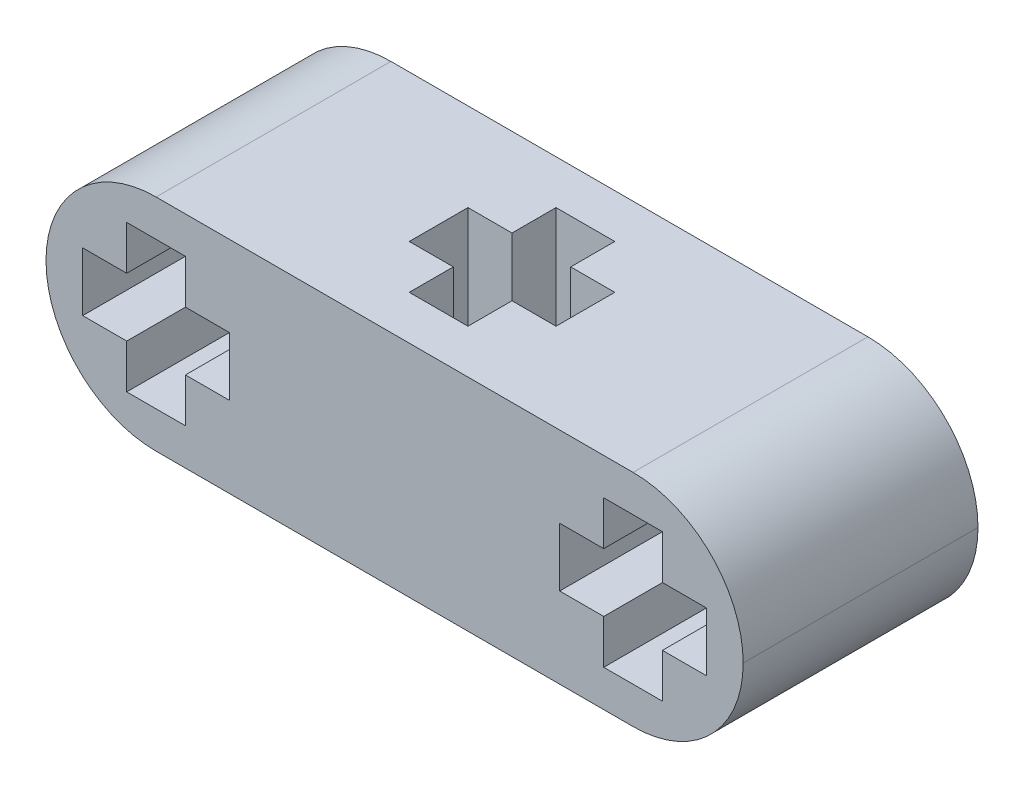
from build123d import *

# Parameters (mm, degrees)
SKETCH1_W           = 23.75
SKETCH1_H           = 7.5
BOSS_EXTRUDE1_DEPTH = 8
FILLET1_R           = 3.75
FILLET2_R           = 3.75
CUT_EXTRUDE13_DEPTH = 27.159367347
CUT_EXTRUDE14_DEPTH = 10


with BuildPart() as part:
    # Sketch1 → Boss-Extrude1 (new body)
    with BuildSketch(Plane.XY):
        with Locations((11.875, 3.75)):
            Rectangle(SKETCH1_W, SKETCH1_H)
    extrude(amount=BOSS_EXTRUDE1_DEPTH)

    # Fillet1
    fillet1_edges = [part.edges().sort_by_distance(p)[0] for p in [
        (23.75, 0, 4),
        (23.75, 7.5, 4),
    ]]
    fillet(fillet1_edges, radius=FILLET1_R - 0.0001)  # a hair under: the kernel refuses the full size

    # Fillet2
    fillet2_edges = [part.edges().sort_by_distance(p)[0] for p in [
        (0, 0, 4),
        (0, 7.5, 4),
    ]]
    fillet(fillet2_edges, radius=FILLET2_R - 0.0001)  # a hair under: the kernel refuses the full size

    # Sketch17 → Cut-Extrude13 (cut, through all)
    with BuildSketch(Plane.XY.offset(8)):
        Polygon((21, 6.25), (20, 6.25), (20, 3.75), (22.5, 3.75), (22.5, 4.75), (21, 4.75), align=None)
        Polygon((20, 3.75), (20, 6.25), (19, 6.25), (19, 4.75), (17.5, 4.75), (17.5, 2.75), (19, 2.75), (19, 1.25), (20, 1.25), align=None)
        Polygon((22.5, 3.75), (20, 3.75), (20, 1.25), (21, 1.25), (21, 2.75), (22.5, 2.75), align=None)
    cut_extrude13 = extrude(amount=-CUT_EXTRUDE13_DEPTH, mode=Mode.SUBTRACT)

    # Mirror4: Cut-Extrude13 across plane
    add(cut_extrude13.mirror(Plane(origin=(11.875, 0, 0), x_dir=(0, 0, 1), z_dir=(1, 0, 0))), mode=Mode.SUBTRACT)

    # Sketch18 → Cut-Extrude14 (cut)
    with BuildSketch(Plane(origin=(0, 7.5, 0), x_dir=(1, 0, 0), z_dir=(0, 1, 0))):
        Polygon((14.375, -4), (11.875, -4), (11.875, -6.5), (12.875, -6.5), (12.875, -5), (14.375, -5), align=None)
        Polygon((11.875, -4), (13.90625, -3), (12.875, -3), (12.875, -1.5), (11.875, -1.5), align=None)
        Polygon((14.375, -3), (13.90625, -3), (11.875, -4), (14.375, -4), align=None)
        Polygon((9.84375, -5), (11.875, -4), (11.875, -1.5), (10.875, -1.5), (10.875, -3), (9.375, -3), (9.375, -5), align=None)
        Polygon((11.875, -6.5), (11.875, -4), (9.84375, -5), (10.875, -5), (10.875, -6.5), align=None)
    extrude(amount=-CUT_EXTRUDE14_DEPTH, mode=Mode.SUBTRACT)


solid = part.part
